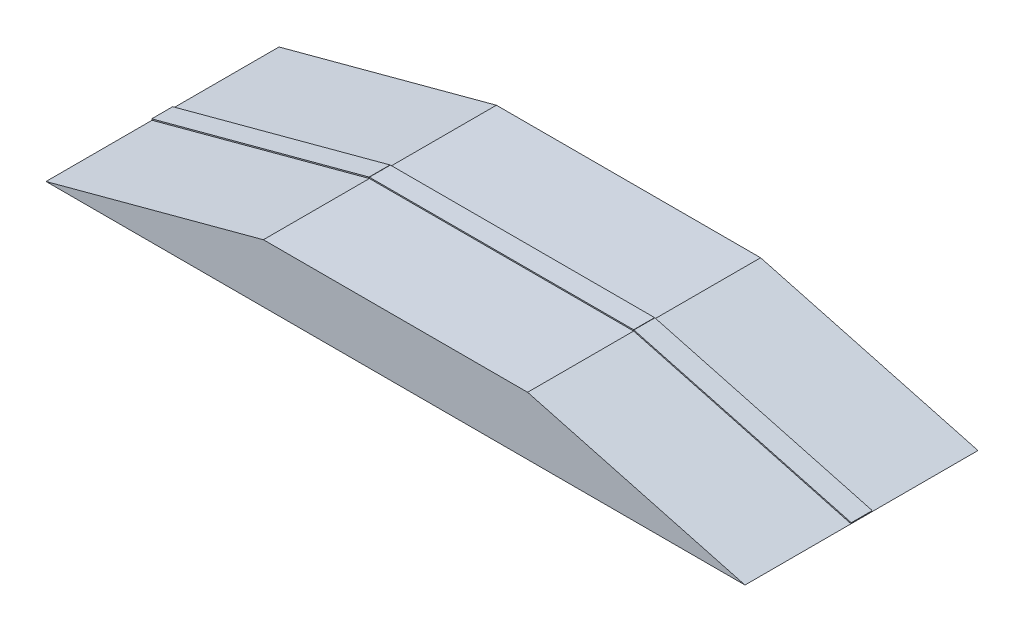
from build123d import *

# Parameters (mm, degrees)
EXTRUDE_1_DEPTH = 100
SKETCH_3_W      = 193.185165257
SKETCH_3_H      = 18
EXTRUDE_2_DEPTH = 1
SKETCH_4_W      = 226.794919244
SKETCH_4_H      = 18
EXTRUDE_3_DEPTH = 1
SKETCH_5_W      = 193.185165258
SKETCH_5_H      = 18
EXTRUDE_4_DEPTH = 1


with BuildPart() as part:
    # 草圖1 → 填料-伸長1 (new, symmetric)
    with BuildSketch(Plane.XY):
        Polygon((0, 0), (600, 0), (413.397459622, 50), (186.602540378, 50), align=None)
    extrude(amount=EXTRUDE_1_DEPTH, both=True)


with BuildPart() as body_2:
    # 草圖3 → 填料-伸長2 (new body)
    with BuildSketch(Plane(origin=(40.192378865, 150, 0), x_dir=(0.96592582628907, -0.25881904510251436, 0), z_dir=(0.25881904510251436, 0.96592582628907, 0))):
        with Locations((482.962913145, 0)):
            Rectangle(SKETCH_3_W, SKETCH_3_H)
    extrude(amount=EXTRUDE_2_DEPTH)


with BuildPart() as body_3:
    # 草圖4 → 填料-伸長3 (new body)
    with BuildSketch(Plane(origin=(0, 50, 0), x_dir=(1, 0, 0), z_dir=(0, 1, 0))):
        with Locations((300, 0)):
            Rectangle(SKETCH_4_W, SKETCH_4_H)
    extrude(amount=EXTRUDE_3_DEPTH)


with BuildPart() as body_4:
    # 草圖5 → 填料-伸長4 (new body)
    with BuildSketch(Plane(origin=(0, 0, 0), x_dir=(0.96592582628907, 0.2588190451025145, 0), z_dir=(-0.2588190451025145, 0.9659258262890701, 0))):
        with Locations((96.592582629, 0)):
            Rectangle(SKETCH_5_W, SKETCH_5_H)
    extrude(amount=EXTRUDE_4_DEPTH)


solid = Compound([part.part, body_2.part, body_3.part, body_4.part])
